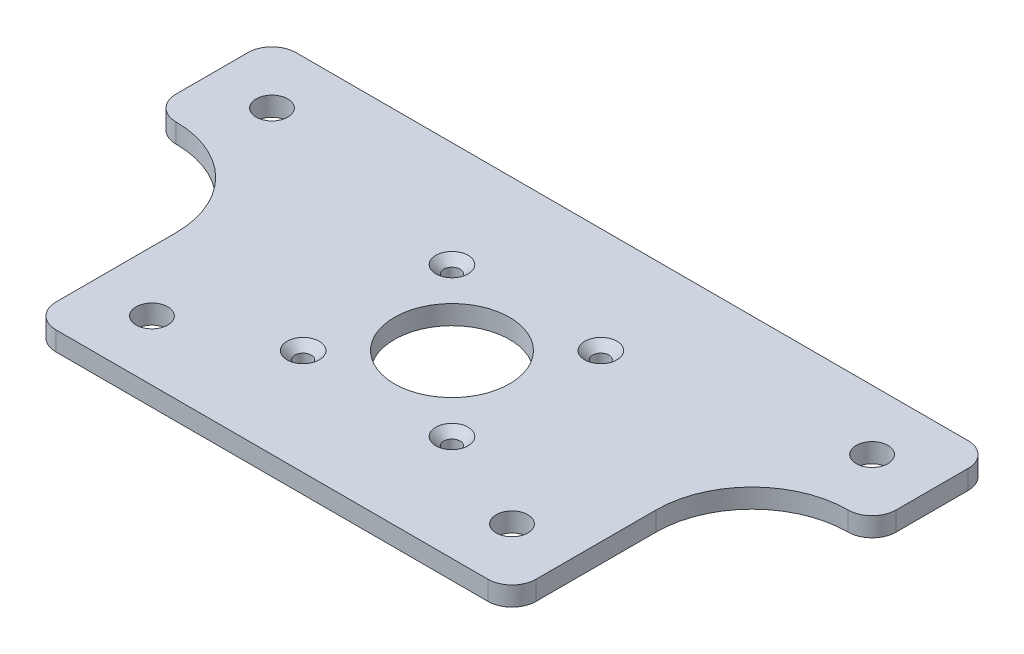
from build123d import *

# Parameters (mm, degrees)
SKETCH1_W                                            = 25
SKETCH1_H                                            = 25
SKETCH1_W_2                                          = 100
SKETCH1_H_2                                          = 75
SKETCH1_R                                            = 12
BOSS_EXTRUDE1_DEPTH                                  = 4
CSK_FOR_M3_HEX_SOCKET_COUNTERSUNK_CAP_SC_D           = 3.4
CSK_FOR_M3_HEX_SOCKET_COUNTERSUNK_CAP_SC_CSINK_D     = 6.72
CSK_FOR_M3_HEX_SOCKET_COUNTERSUNK_CAP_SC_CSINK_ANGLE = 90
M6_CLEARANCE_HOLE2_D                                 = 6.6
FILLET1_R                                            = 5
FILLET2_R                                            = 20


with BuildPart() as part:
    # Sketch1 → Boss-Extrude1 (new body)
    # profile 1 of 3: a face of its own
    with BuildSketch(Plane(origin=(0, 0, 0), x_dir=(1, 0, 0), z_dir=(0, 1, 0))):
        with Locations((-62.5, 25)):
            Rectangle(SKETCH1_W, SKETCH1_H)
    # profile 2 of 3: a face of its own
    with BuildSketch(Plane(origin=(0, 0, 0), x_dir=(1, 0, 0), z_dir=(0, 1, 0))):
        Rectangle(SKETCH1_W_2, SKETCH1_H_2)
        with Locations(Location((0, 0, 0), (0, 0, 270))):
            Circle(SKETCH1_R, mode=Mode.SUBTRACT)
    # profile 3 of 3: a face of its own
    with BuildSketch(Plane(origin=(0, 0, 0), x_dir=(1, 0, 0), z_dir=(0, 1, 0))):
        with Locations((62.5, 25)):
            Rectangle(SKETCH1_W, SKETCH1_H)
    extrude(amount=BOSS_EXTRUDE1_DEPTH)

    # CSK for M3 Hex Socket Countersunk Cap Screw1 (through all)
    with Locations(Plane(origin=(-15.5, 4, 15.5), x_dir=(0, 0, 1), z_dir=(0, 1, 0))):
        with Locations((0, 0), (0, 31), (-31, 31), (-31, 0)):
            CounterSinkHole(CSK_FOR_M3_HEX_SOCKET_COUNTERSUNK_CAP_SC_D / 2, CSK_FOR_M3_HEX_SOCKET_COUNTERSUNK_CAP_SC_CSINK_D / 2, counter_sink_angle=CSK_FOR_M3_HEX_SOCKET_COUNTERSUNK_CAP_SC_CSINK_ANGLE)

    # M6 Clearance Hole2 (through all)
    with Locations(Plane(origin=(0, 0, 0), x_dir=(-1, 0, 0), z_dir=(0, -1, 0))):
        with Locations((62.5, 25), (37.5, -25), (-37.5, -25), (-62.5, 25)):
            Hole(M6_CLEARANCE_HOLE2_D / 2)

    # Fillet1
    fillet1_edges = [part.edges().sort_by_distance(p)[0] for p in [
        (75, 2, -37.5),
        (75, 2, -12.5),
        (50, 2, 37.5),
        (-50, 2, 37.5),
        (-75, 2, -12.5),
        (-75, 2, -37.5),
    ]]
    fillet(fillet1_edges, radius=FILLET1_R)

    # Fillet2
    fillet2_edges = [part.edges().sort_by_distance(p)[0] for p in [
        (50, 2, -12.5),
        (-50, 2, -12.5),
    ]]
    fillet(fillet2_edges, radius=FILLET2_R - 0.0001)  # a hair under: the kernel refuses the full size


solid = part.part
